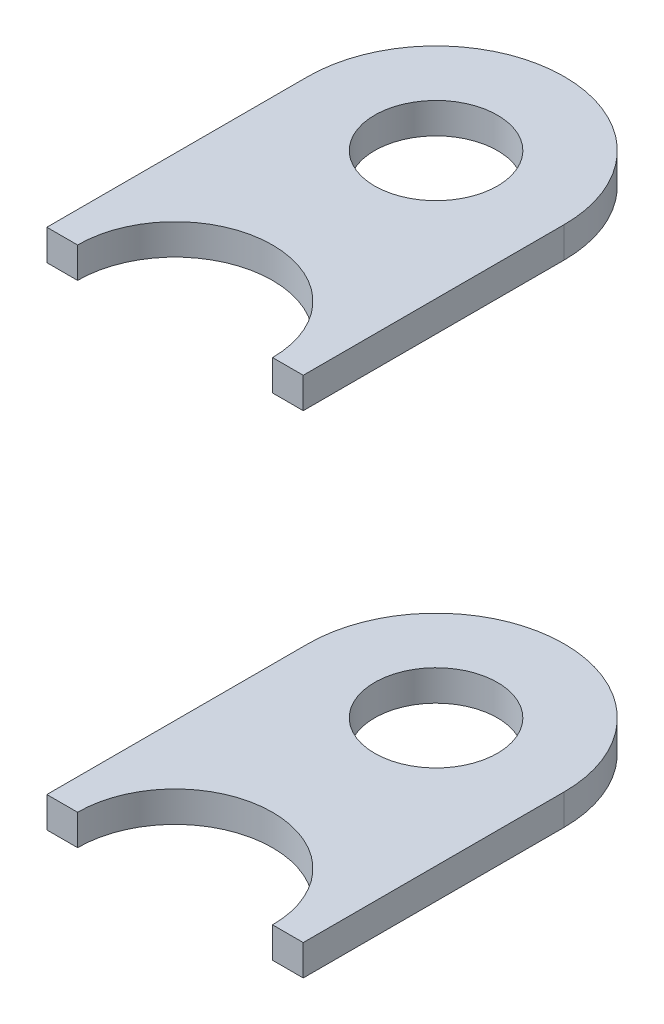
from build123d import *

# Parameters (mm, degrees)
SKETCH1_R           = 8
BOSS_EXTRUDE1_DEPTH = 4


with BuildPart() as part:
    # Sketch1 → Boss-Extrude1 (new body)
    with BuildSketch(Plane(origin=(0, 30, 0), x_dir=(1, 0, 0), z_dir=(0, 1, 0))):
        with BuildLine():
            Line((16.7, -34), (12.7, -34))
            ThreePointArc((12.7, -34), (0, -21.3), (-12.7, -34))
            Line((-12.7, -34), (-16.7, -34))
            Line((-16.7, -34), (-16.7, 0))
            ThreePointArc((-16.7, 0), (0, 16.7), (16.7, 0))
            Line((16.7, 0), (16.7, -34))
        make_face()
        Circle(SKETCH1_R, mode=Mode.SUBTRACT)
    extrude(amount=BOSS_EXTRUDE1_DEPTH)


with BuildPart() as body_2:
    # Mirror2: mirrored copy
    add(part.part.mirror(Plane.ZX))


solid = Compound([part.part, body_2.part])
